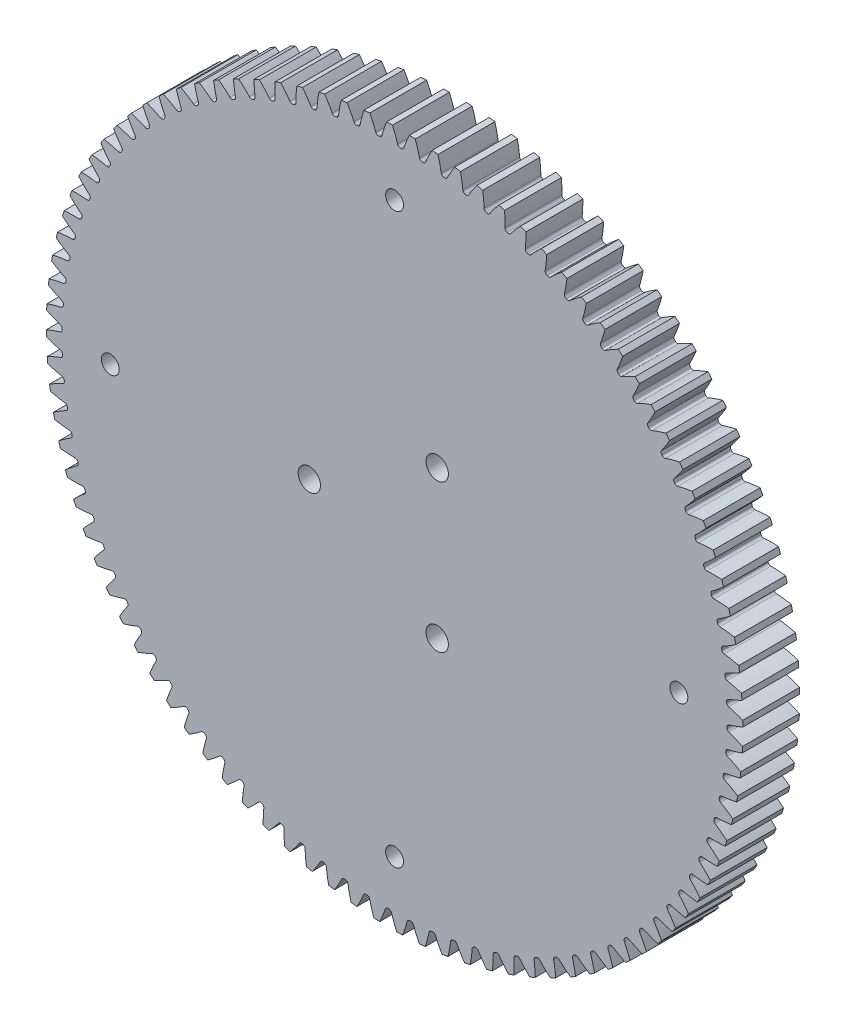
from build123d import *

# Parameters (mm, degrees)
SKETCH3_R          = 77.7875
GEARBODY_DEPTH     = 12.7
TOOTHCUT_DEPTH     = 111.738793169
CIRPATTERN1_COUNT  = 96
SKETCH4_R          = 2.499999953
CUT_EXTRUDE1_DEPTH = 111.736892249
SKETCH5_R          = 2.000000064
CUT_EXTRUDE2_DEPTH = 111.736892249


with BuildPart() as part:
    # Sketch3 → gearBody (new body)
    with BuildSketch(Plane.XY):
        Circle(SKETCH3_R)
    extrude(amount=GEARBODY_DEPTH)

    # Sketch2 → toothCut (cut, through all)
    with BuildSketch(Plane.XY):
        with BuildLine():
            ThreePointArc((74.229645105, -1.470041256), (74.231652244, -1.364931764), (74.233510549, -1.259819536))
            ThreePointArc((74.233510549, -1.259819536), (74.357469475, -0.900065574), (74.669516207, -0.682314421))
            ThreePointArc((74.669516207, -0.682314421), (83.521868489, 3.746156538), (90.39842703, 10.865737887))
            ThreePointArc((90.39842703, 10.865737887), (91.033719016, -1.673879146), (89.937868837, -14.181664866))
            ThreePointArc((89.937868837, -14.181664866), (83.327692223, -6.814096673), (74.644125506, -2.063184652))
            ThreePointArc((74.644125506, -2.063184652), (74.340294784, -1.834109074), (74.229645105, -1.470041256))
        make_face()
    toothcut = extrude(amount=TOOTHCUT_DEPTH, mode=Mode.SUBTRACT)

    # CirPattern1: toothCut ×96 about axis
    cirpattern1_axis = Axis((0, 0, 12.7), (0, 0, -1))
    for i in range(1, CIRPATTERN1_COUNT):
        add(toothcut.rotate(cirpattern1_axis, i * 360 / CIRPATTERN1_COUNT), mode=Mode.SUBTRACT)

    # Sketch4 → Cut-Extrude1 (cut, through all)
    with BuildSketch(Plane(origin=(0, 0, 0), x_dir=(-1, 0, 0), z_dir=(0, 0, -1))):
        with Locations((19.05, 0)):
            Circle(SKETCH4_R)
        with Locations((-9.525, -16.497783942)):
            Circle(SKETCH4_R)
        with Locations((-9.525, 16.497783942)):
            Circle(SKETCH4_R)
    extrude(amount=-CUT_EXTRUDE1_DEPTH, mode=Mode.SUBTRACT)

    # Sketch5 → Cut-Extrude2 (cut, through all)
    with BuildSketch(Plane(origin=(0, 0, 0), x_dir=(-1, 0, 0), z_dir=(0, 0, -1))):
        with Locations((63.5, 0)):
            Circle(SKETCH5_R)
        with Locations((0, -63.5)):
            Circle(SKETCH5_R)
        with Locations((-63.5, 0)):
            Circle(SKETCH5_R)
        with Locations((0, 63.5)):
            Circle(SKETCH5_R)
    extrude(amount=-CUT_EXTRUDE2_DEPTH, mode=Mode.SUBTRACT)


solid = part.part
